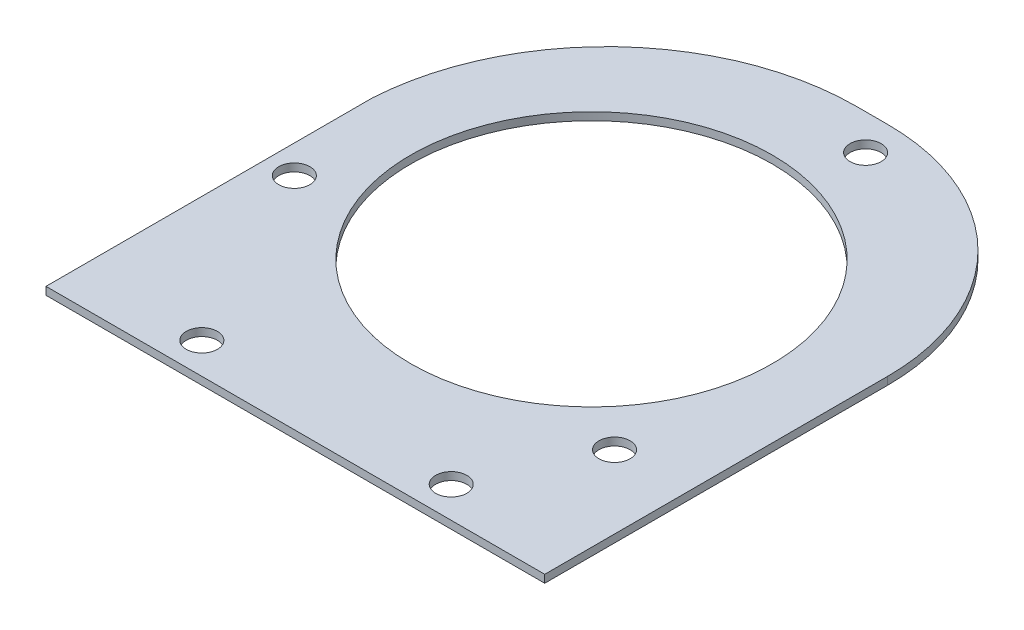
from build123d import *

# Parameters (mm, degrees)
SKETCH1_R           = 73.66
SKETCH1_R_2         = 6.35
BOSS_EXTRUDE1_DEPTH = 3.175


with BuildPart() as part:
    # Sketch1 → Boss-Extrude1 (new body)
    with BuildSketch(Plane(origin=(0, 0, 0), x_dir=(1, 0, 0), z_dir=(0, 1, 0))):
        with BuildLine():
            Line((12.7, 114.3), (0, 114.3))
            ThreePointArc((0, 114.3), (-69.761055355, 86.634356609), (-101.6, 18.676470588))
            Line((-101.6, 18.676470588), (-101.6, -114.3))
            Line((-101.6, -114.3), (101.6, -114.3))
            Line((101.6, -114.3), (101.6, 25.4))
            ThreePointArc((101.6, 25.4), (75.561792847, 88.261792847), (12.7, 114.3))
        make_face()
        with Locations((0, 6.35)):
            Circle(SKETCH1_R, mode=Mode.SUBTRACT)
        with Locations((-90.060644326, -24.660366712)):
            Circle(SKETCH1_R_2, mode=Mode.SUBTRACT)
        with Locations((-50.8, -101.6)):
            Circle(SKETCH1_R_2, mode=Mode.SUBTRACT)
        with Locations((50.8, -101.6)):
            Circle(SKETCH1_R_2, mode=Mode.SUBTRACT)
        with Locations((18.17455681, 99.849989223)):
            Circle(SKETCH1_R_2, mode=Mode.SUBTRACT)
        with Locations((71.886087516, -56.139622511)):
            Circle(SKETCH1_R_2, mode=Mode.SUBTRACT)
    extrude(amount=BOSS_EXTRUDE1_DEPTH)


solid = part.part
